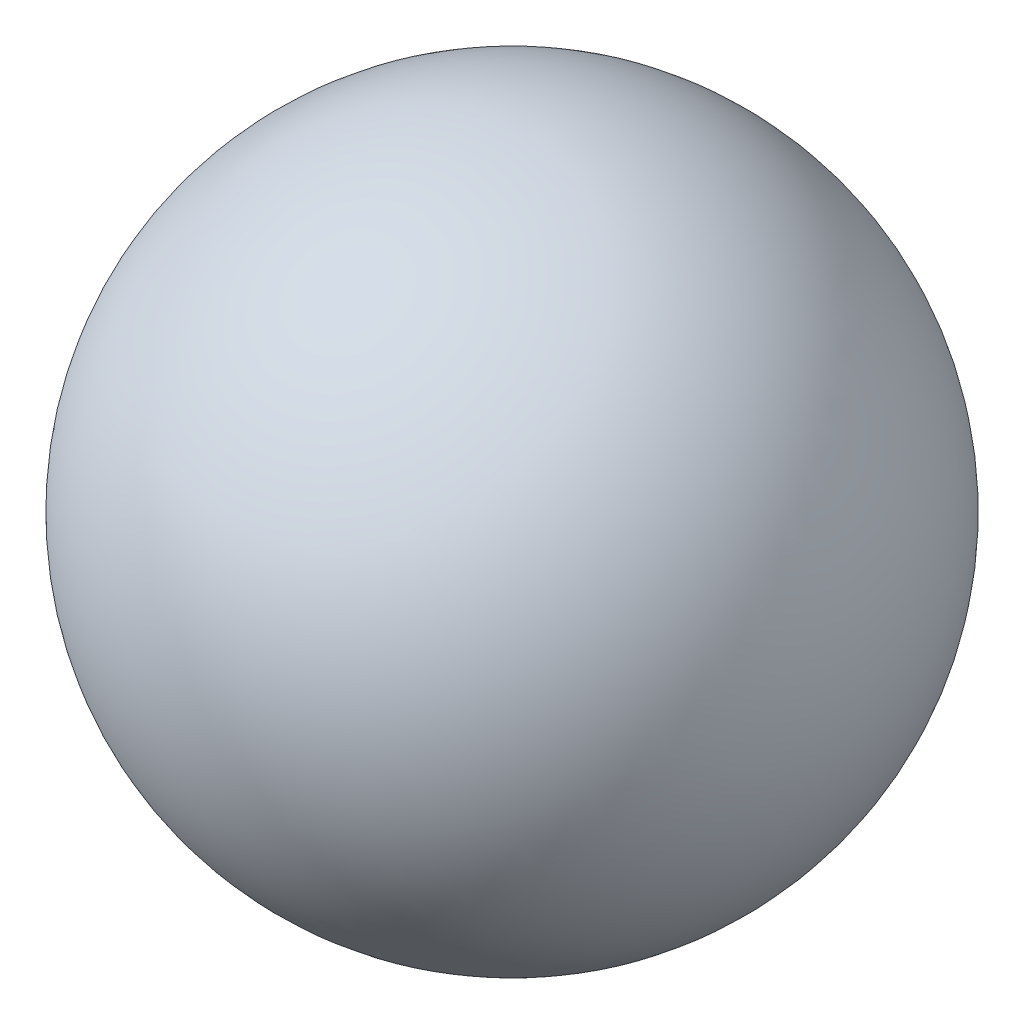
from build123d import *


with BuildPart() as part:
    # ｽｹｯﾁ1 → 回転1 (revolve)
    with BuildSketch(Plane.XY):
        with BuildLine():
            ThreePointArc((0, -125), (125, 0), (0, 125))
            Line((0, 125), (0, -125))
        make_face()
    revolve(axis=Axis((0, 125, 0), (0, -1, 0)))


solid = part.part
